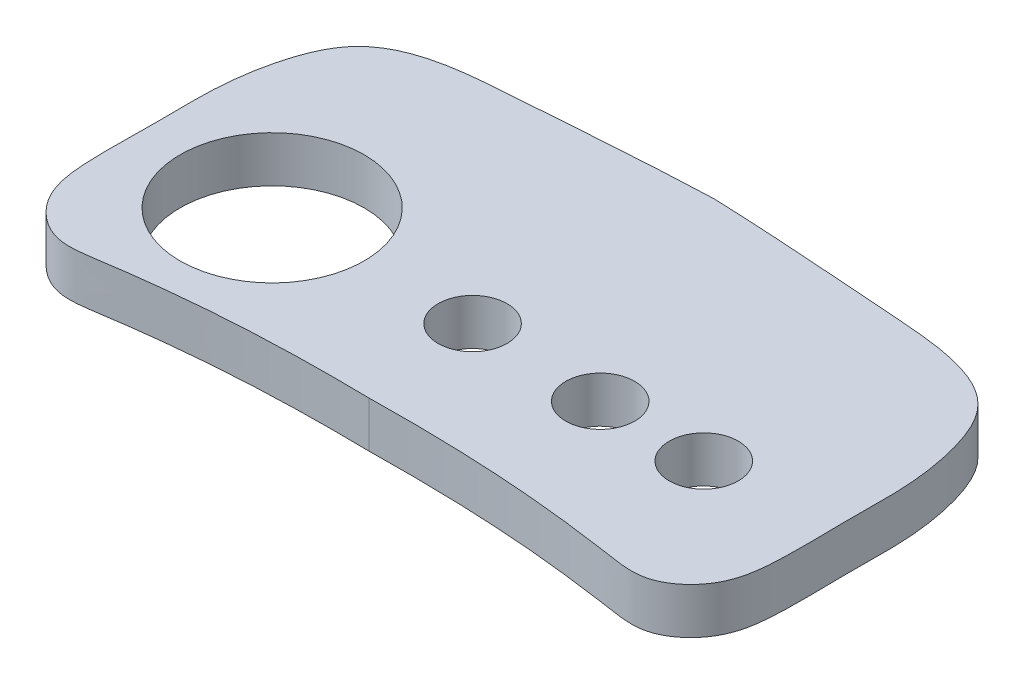
from build123d import *

# Parameters (mm, degrees)
Y_KSEKLIK_EKSTR_ZYON1_DEPTH = 4
IZIM2_R                     = 8
IZIM2_R_2                   = 3
KES_EKSTR_ZYON1_DEPTH       = 10


with BuildPart() as part:
    # Çizim1 → Yükseklik-Ekstrüzyon1 (new body)
    with BuildSketch(Plane(origin=(0, 0, 0), x_dir=(1, 0, 0), z_dir=(0, 1, 0))):
        with BuildLine():
            add(Edge.make_bspline(
                [(0, 17.928841308), (-5.820212095, 17.709536244), (-13.903357487, 17.042587637), (-26.87571665, 16.196014495), (-29.550286899, 8.929250371), (-30.090469717, 4.336098712), (-29.940693307, -0.887353996), (-30.154927851, -5.701691423), (-29.637182829, -10.928766593), (-26.031174583, -14.081750554), (-15.720131404, -12.349312728), (-7.807226576, -11.938879102), (0, -12.071158692)],
                knots=[0, 0, 0, 0, 0.198459501, 0.336012796, 0.394476639, 0.459729731, 0.505376957, 0.582750838, 0.635932872, 0.690008906, 0.731880659, 1, 1, 1, 1], degree=3))
            add(Edge.make_bspline(
                [(0, 17.928841308), (5.820212095, 17.709536244), (13.903357487, 17.042587637), (26.87571665, 16.196014495), (29.550286899, 8.929250371), (30.090469717, 4.336098712), (29.940693307, -0.887353996), (30.154927851, -5.701691423), (29.637182829, -10.928766593), (26.031174583, -14.081750554), (15.720131404, -12.349312728), (7.807226576, -11.938879102), (0, -12.071158692)],
                knots=[0, 0, 0, 0, 0.198459501, 0.336012796, 0.394476639, 0.459729731, 0.505376957, 0.582750838, 0.635932872, 0.690008906, 0.731880659, 1, 1, 1, 1], degree=3))
        make_face()
    extrude(amount=Y_KSEKLIK_EKSTR_ZYON1_DEPTH)

    # Çizim2 → Kes-Ekstrüzyon1 (cut)
    with BuildSketch(Plane(origin=(0, 4, 0), x_dir=(1, 0, 0), z_dir=(0, 1, 0))):
        with Locations((-18.527748167, -1.962499381)):
            Circle(IZIM2_R)
        with Locations((-1.102266972, -1.962499381)):
            Circle(IZIM2_R_2)
        with Locations((10.293462547, -2.261963976)):
            Circle(IZIM2_R_2)
        with Locations((19.293462547, -2.261963976)):
            Circle(IZIM2_R_2)
    extrude(amount=-KES_EKSTR_ZYON1_DEPTH, mode=Mode.SUBTRACT)


solid = part.part
